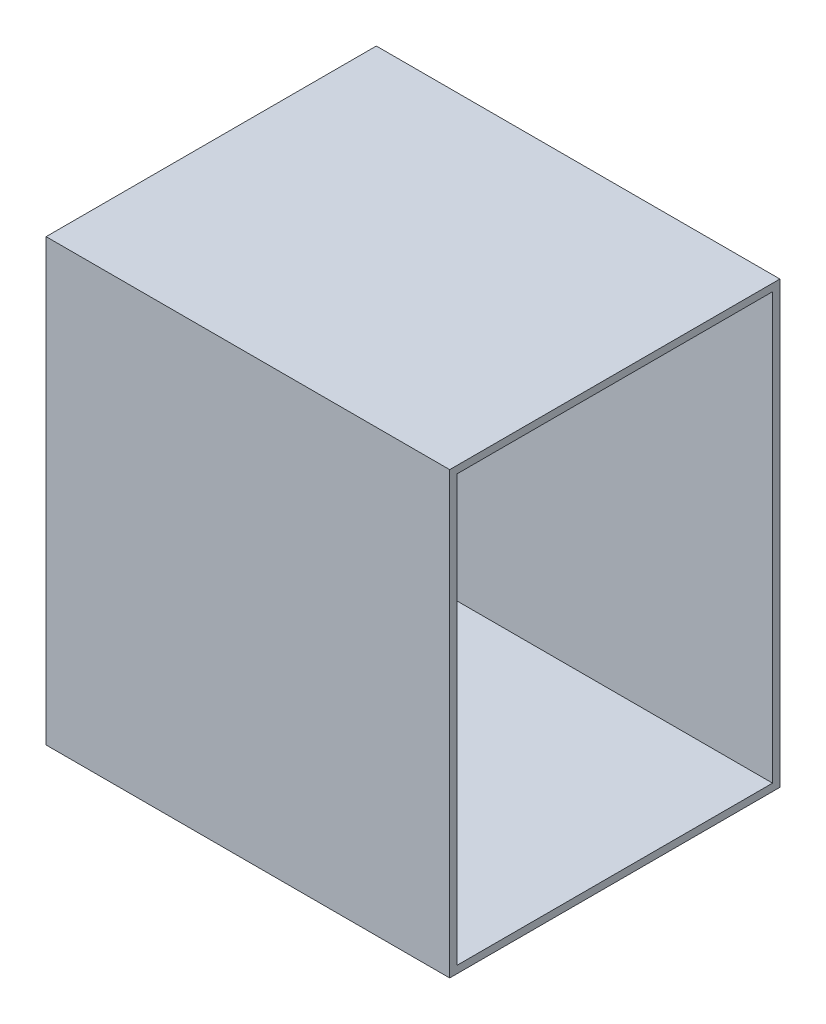
from build123d import *

# Parameters (mm, degrees)
SKETCH1_W           = 90
SKETCH1_H           = 120
SKETCH1_W_2         = 86
SKETCH1_H_2         = 116
BOSS_EXTRUDE1_DEPTH = 110


with BuildPart() as part:
    # Sketch1 → Boss-Extrude1 (new body)
    with BuildSketch(Plane(origin=(-0.158348274, 0, 0), x_dir=(0, 0, -1), z_dir=(1, 0, 0))):
        with Locations((-45.603420955, 49.0183562)):
            Rectangle(SKETCH1_W, SKETCH1_H)
        with Locations((-45.603420955, 49.0183562)):
            Rectangle(SKETCH1_W_2, SKETCH1_H_2, mode=Mode.SUBTRACT)
    extrude(amount=BOSS_EXTRUDE1_DEPTH)


solid = part.part
